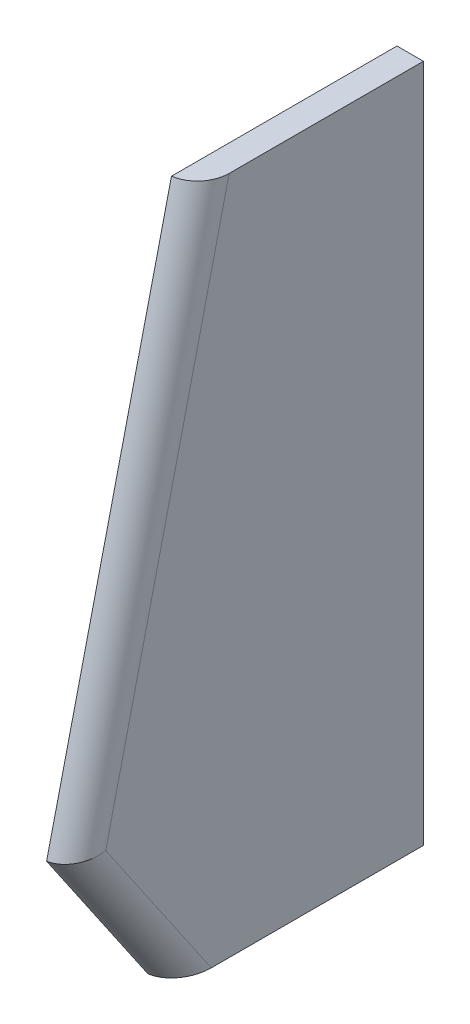
from build123d import *

# Parameters (mm, degrees)
BOSS_EXTRUDE1_DEPTH = 8.6
FILLET1_R           = 10


with BuildPart() as part:
    # Sketch1 → Boss-Extrude1 (new body)
    with BuildSketch(Plane(origin=(0, 0, 0), x_dir=(0, 0, -1), z_dir=(1, 0, 0))):
        Polygon((-20.418398158, -27.648727352), (93.581601842, -27.648727352), (93.592230689, 145.071272648), (20.221601872, 145.071272648), align=None)
        Polygon((93.581601842, -27.648727352), (93.592230689, -75.908727352), (12.587404818, -75.908727352), (-20.418398158, -27.648727352), align=None)
    extrude(amount=BOSS_EXTRUDE1_DEPTH)

    # Fillet1
    # the kernel refuses this fillet: 10 mm, written as the material it takes off along each edge
    with BuildSketch(Plane(origin=(8.6, -96.341008807, -26.561376141), x_dir=(0, 0.5645185114814042, -0.825420408152609), z_dir=(0, 0.825420408152609, 0.5645185114814043))) as fillet1_piece_1:
        with BuildLine():
            CenterArc((9.901515036, 10), FILLET1_R, 188.047846247, 81.952153753)
            Line((0, 8.6), (-0.198030301, 8.572))
            ThreePointArc((-0.198030301, 8.572), (-0.2, 4.3), (-0.2, 0))
            Line((-0.2, 0), (0, -0.2))
            Line((0, -0.2), (9.901515036, -0.2))
            Line((9.901515036, -0.2), (9.901515036, 0))
        make_face()
    extrude(amount=107.974750842, mode=Mode.SUBTRACT)
    with BuildSketch(Plane(origin=(8.6, 169.167034468, -25.891192892), x_dir=(0, -0.22903933388604258, -0.9734171682958124), z_dir=(0, -0.9734171682958125, 0.22903933388604258))) as fillet1_piece_2:
        with BuildLine():
            CenterArc((9.901515036, -10), FILLET1_R, 90, 81.952153753)
            Line((0, -8.6), (-0.198030301, -8.572))
            ThreePointArc((-0.198030301, -8.572), (-0.2, -4.3), (-0.2, 0))
            Line((-0.2, 0), (0, 0.2))
            Line((0, 0.2), (9.901515036, 0.2))
            Line((9.901515036, 0.2), (9.901515036, 0))
        make_face()
    extrude(amount=226.944347022, mode=Mode.SUBTRACT)


solid = part.part
